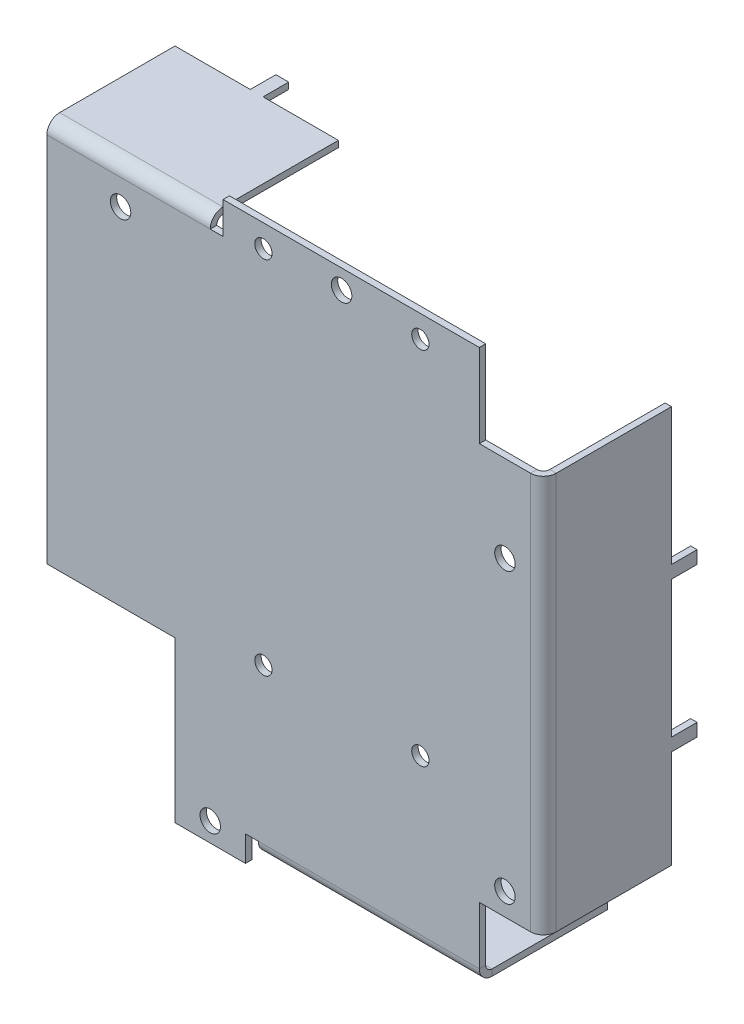
from build123d import *

# Parameters (mm, degrees)
BOSS_EXTRUDE2_DEPTH            = 1
F_3_2_3_2_DIAMETER_HOLE1_D     = 3.2
F_3_2_3_2_DIAMETER_HOLE1_DEPTH = 1.6
F_3_2_3_2_DIAMETER_HOLE1_TIP   = 0.96137699
F_2_7_2_7_DIAMETER_HOLE1_D     = 2.7
F_2_7_2_7_DIAMETER_HOLE1_DEPTH = 1.6
F_2_7_2_7_DIAMETER_HOLE1_TIP   = 0.811161836
EDGE_FLANGE1_DEPTH             = 62
EDGE_FLANGE1_START             = 1
EDGE_FLANGE1_FLAT_DEPTH        = 1
EDGE_FLANGE1_BEND_DEPTH        = 25.5
EDGE_FLANGE1_FLAT_2_DEPTH      = 1
EDGE_FLANGE1_BEND_2_DEPTH      = 34.5
EDGE_FLANGE1_FLAT_3_DEPTH      = 1


# Sheet-metal steps are written as plain solids
with BuildPart() as part:
    # Sketch1 → Boss-Extrude2 (new body)
    with BuildSketch(Plane.XY.offset(10)):
        Polygon((-44.583280636, -10.201603144), (-24.583280636, -10.201603144), (-24.583280636, -35.201603144), (-13.583280636, -35.201603144), (-13.583280636, -31.201603144), (22.916719364, -31.201603144), (22.916719364, -22.201603144), (30.916719364, -22.201603144), (30.916719364, 39.798396856), (22.916719364, 39.798396856), (22.916719364, 52.798396856), (-17.083280636, 52.798396856), (-17.083280636, 47.798396856), (-44.583280636, 47.798396856), align=None)
    extrude(amount=BOSS_EXTRUDE2_DEPTH)

    # Ø3.2 (3.2) Diameter Hole1
    with Locations(Plane.XY.offset(11)):
        with Locations((-33.083280636, 43.798396856), (26.916719364, 26.298396856), (26.916719364, -18.701603144), (1.416719364, 49.798396856), (-19.083280636, -32.201603144)):
            Hole(F_3_2_3_2_DIAMETER_HOLE1_D / 2, depth=F_3_2_3_2_DIAMETER_HOLE1_DEPTH)
            with Locations((0, 0, -(F_3_2_3_2_DIAMETER_HOLE1_DEPTH + F_3_2_3_2_DIAMETER_HOLE1_TIP / 2))):  # 118° drill point
                Cone(0, F_3_2_3_2_DIAMETER_HOLE1_D / 2, F_3_2_3_2_DIAMETER_HOLE1_TIP, mode=Mode.SUBTRACT)

    # Ø2.7 (2.7) Diameter Hole1
    with Locations(Plane.XY.offset(11)):
        with Locations((-10.783280636, -6.994496363), (13.716719364, -6.994496363), (-10.783280636, 49.298396856), (13.716719364, 49.298396856)):
            Hole(F_2_7_2_7_DIAMETER_HOLE1_D / 2, depth=F_2_7_2_7_DIAMETER_HOLE1_DEPTH)
            with Locations((0, 0, -(F_2_7_2_7_DIAMETER_HOLE1_DEPTH + F_2_7_2_7_DIAMETER_HOLE1_TIP / 2))):  # 118° drill point
                Cone(0, F_2_7_2_7_DIAMETER_HOLE1_D / 2, F_2_7_2_7_DIAMETER_HOLE1_TIP, mode=Mode.SUBTRACT)

    # Edge-Flange1 bend section (across the edge) → Edge-Flange1 (add)
    with BuildSketch(Plane(origin=(31.916719364, 39.798396856, 10), x_dir=(-1, 0, 0), z_dir=(0, -1, 0))):
        with BuildLine():
            Line((-1, 1), (0, 1))
            ThreePointArc((0, 1), (0.292893219, 0.292893219), (1, 0))
            Line((1, 0), (1, -1))
            ThreePointArc((1, -1), (-0.414213562, -0.414213562), (-1, 1))
        make_face()
    extrude(amount=EDGE_FLANGE1_DEPTH)

    # Edge-Flange1 profile (on flange) → Edge-Flange1 flat (add)
    with BuildSketch(Plane(origin=(31.916719364, 0, 10), x_dir=(0, -1, 0), z_dir=(1, 0, 0)).offset(EDGE_FLANGE1_START)):
        Polygon((-39.798396856, 1), (22.201603144, 1), (22.201603144, 19), (6.871603144, 19), (6.871603144, 23), (4.871603144, 23), (4.871603144, 19), (-16.468396856, 19), (-16.468396856, 23), (-18.468396856, 23), (-18.468396856, 19), (-39.798396856, 19), align=None)
    extrude(amount=-EDGE_FLANGE1_FLAT_DEPTH)

    # Edge-Flange1 bend section 2 (across the edge) → Edge-Flange1 bend (add)
    with BuildSketch(Plane(origin=(-44.583280636, 48.798396856, 10), x_dir=(0, -1, 0), z_dir=(1, 0, 0))):
        with BuildLine():
            Line((-1, 1), (0, 1))
            ThreePointArc((0, 1), (0.292893219, 0.292893219), (1, 0))
            Line((1, 0), (1, -1))
            ThreePointArc((1, -1), (-0.414213562, -0.414213562), (-1, 1))
        make_face()
    extrude(amount=EDGE_FLANGE1_BEND_DEPTH)

    # Edge-Flange1 profile 2 (on flange) → Edge-Flange1 flat 2 (add)
    with BuildSketch(Plane(origin=(0, 48.798396856, 10), x_dir=(1, 0, 0), z_dir=(0, 1, 0)).offset(EDGE_FLANGE1_START)):
        Polygon((-19.083280636, 1), (-19.083280636, 19), (-30.833280636, 19), (-30.833280636, 23), (-32.833280636, 23), (-32.833280636, 19), (-44.583280636, 19), (-44.583280636, 1), align=None)
    extrude(amount=-EDGE_FLANGE1_FLAT_2_DEPTH)

    # Edge-Flange1 bend section 3 (across the edge) → Edge-Flange1 bend 2 (add)
    with BuildSketch(Plane(origin=(22.916719364, -32.201603144, 10), x_dir=(0, 1, 0), z_dir=(-1, 0, 0))):
        with BuildLine():
            Line((-1, 1), (0, 1))
            ThreePointArc((0, 1), (0.292893219, 0.292893219), (1, 0))
            Line((1, 0), (1, -1))
            ThreePointArc((1, -1), (-0.414213562, -0.414213562), (-1, 1))
        make_face()
    extrude(amount=EDGE_FLANGE1_BEND_2_DEPTH)

    # Edge-Flange1 profile 3 (on flange) → Edge-Flange1 flat 3 (add)
    with BuildSketch(Plane(origin=(0, -32.201603144, 10), x_dir=(-1, 0, 0), z_dir=(0, -1, 0)).offset(EDGE_FLANGE1_START)):
        Polygon((11.583280636, 1), (11.583280636, 19), (-4.666719364, 19), (-4.666719364, 23), (-6.666719364, 23), (-6.666719364, 19), (-22.916719364, 19), (-22.916719364, 1), align=None)
    extrude(amount=-EDGE_FLANGE1_FLAT_3_DEPTH)


solid = part.part
